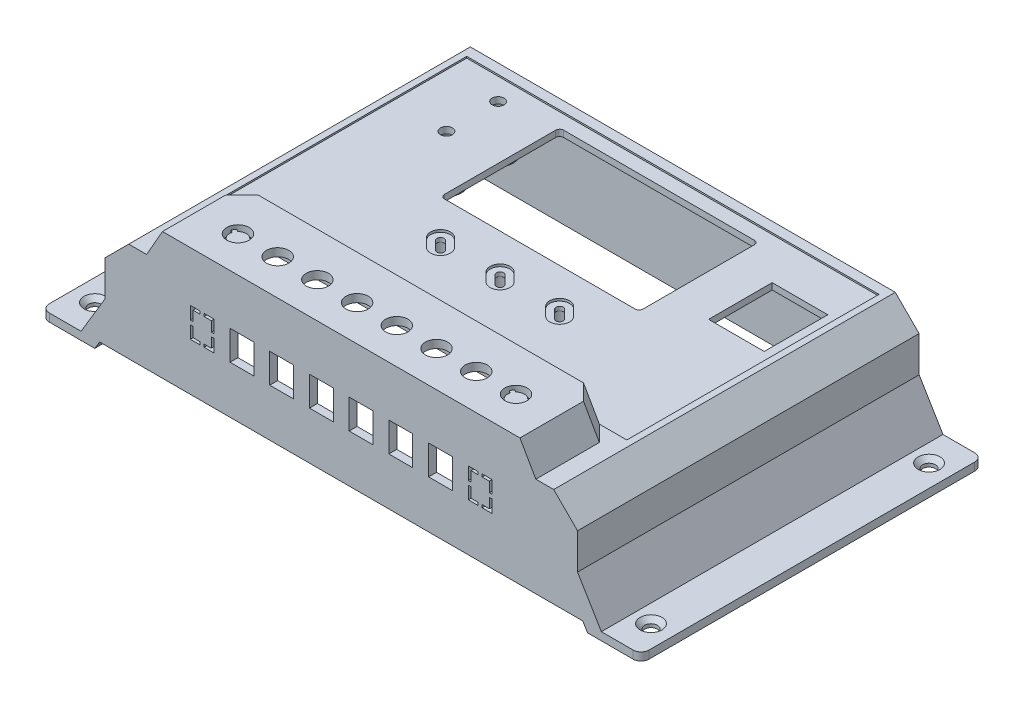
from build123d import *

# Parameters (mm, degrees)
MAIN_BODY_DEPTH           = 43
SHELL1_START              = -41
SHELL1_DEPTH              = 82
SHELL1_START_2            = 27.747091572
SHELL1_2_DEPTH            = 13.252908428
CUT_EXTRUDE2_DEPTH        = 94.301929404
CUT_EXTRUDE2_DEPTH_BACK   = 94.301929404
BOSS_EXTRUDE3_REACH       = 93.92
SKETCH9_R                 = 2.5
SKETCH9_R_2               = 1
BOSS_EXTRUDE4_REACH       = 92.14
SKETCH12_R                = 2.5
SKETCH12_R_2              = 1
MIRROR4_COPY_1_REACH      = 93.92
MIRROR4_COPY_1_SKETCH_R   = 2.5
MIRROR4_COPY_1_SKETCH_R_2 = 1
MIRROR4_COPY_2_REACH      = 92.14
MIRROR4_COPY_2_SKETCH_R   = 2.5
MIRROR4_COPY_2_SKETCH_R_2 = 1
CUT_EXTRUDE3_REACH        = 92.985
SKETCH10_W                = 50
SKETCH10_H                = 30
CUT_EXTRUDE4_REACH        = 92.985
SKETCH11_W                = 14
SKETCH11_H                = 16
CUT_EXTRUDE5_DEPTH        = 91.984889015
BOSS_EXTRUDE9_START       = -1
BOSS_EXTRUDE9_DEPTH       = 1
SKETCH26_R                = 3.4
SKETCH26_R_2              = 2.4
BOSS_EXTRUDE10_DEPTH      = 5.5
SKETCH28_W                = 1
SKETCH28_H                = 6.8
CUT_EXTRUDE10_DEPTH       = 5.5
LPATTERN1_COUNT           = 2
LPATTERN1_PITCH           = 15
LPATTERN1_COL_COUNT       = 2
LPATTERN1_COL_PITCH       = 15
SKETCH14_R                = 1.5
CUT_EXTRUDE6_DEPTH        = 91.984889015
SKETCH15_R                = 2.8
CUT_EXTRUDE7_DEPTH        = 94.301929404
CUT_EXTRUDE8_REACH        = 121.383
SKETCH16_W                = 6
SKETCH16_H                = 7.4
LPATTERN2_COUNT           = 4
LPATTERN2_PITCH           = 10
MIRROR5_COPY_1_SKETCH_R   = 2.8
MIRROR5_COPY_1_DEPTH      = 94.301929404
MIRROR5_COPY_2_SKETCH_R   = 2.8
MIRROR5_COPY_2_DEPTH      = 94.301929404
MIRROR5_COPY_3_SKETCH_R   = 2.8
MIRROR5_COPY_3_DEPTH      = 94.301929404
MIRROR5_COPY_4_REACH      = 121.383
MIRROR5_COPY_4_SKETCH_W   = 6
MIRROR5_COPY_4_SKETCH_H   = 7.4
MIRROR5_COPY_5_REACH      = 121.383
MIRROR5_COPY_5_SKETCH_W   = 6
MIRROR5_COPY_5_SKETCH_H   = 7.4
MIRROR5_COPY_6_REACH      = 121.383
MIRROR5_COPY_6_SKETCH_W   = 6
MIRROR5_COPY_6_SKETCH_H   = 7.4
SKETCH17_R                = 3.75
SKETCH17_R_2              = 1.8
BOSS_EXTRUDE5_DEPTH       = 10
SKETCH18_W                = 1
SKETCH18_H                = 7.4
EXTRUDE_THIN1_DEPTH       = 2
SKETCH19_W                = 6
SKETCH19_H                = 1
EXTRUDE_THIN2_DEPTH       = 2
SKETCH20_W                = 4.6
SKETCH20_H                = 6
BOSS_EXTRUDE6_DEPTH       = 2
SKETCH21_W                = 1
SKETCH21_H                = 2.8
EXTRUDE_THIN3_DEPTH       = 1
CIRPATTERN1_COUNT         = 3
SKETCH22_R                = 2.1
BOSS_EXTRUDE7_DEPTH       = 1
MIRROR6_COPY_1_SKETCH_W   = 1
MIRROR6_COPY_1_SKETCH_H   = 2.8
MIRROR6_COPY_1_DEPTH      = 1
MIRROR6_COPY_2_SKETCH_W   = 1
MIRROR6_COPY_2_SKETCH_H   = 2.8
MIRROR6_COPY_2_DEPTH      = 1
CUT_EXTRUDE9_REACH        = 121.383
SKETCH23_W                = 5.8
SKETCH23_H                = 7.3
SKETCH24_W                = 1
SKETCH24_H                = 7.3
SKETCH24_W_2              = 5.8
SKETCH24_H_2              = 1
EXTRUDE_THIN4_DEPTH       = 1
SKETCH25_W                = 3.8
SKETCH25_H                = 5.3
BOSS_EXTRUDE8_DEPTH       = 1
SKETCH29_W                = 103.8
SKETCH29_H                = 63.5
CUT_EXTRUDE11_DEPTH       = 0.4
FILLET1_R                 = 1
FILLET2_R                 = 2


with BuildPart() as part:
    # Sketch1 → MAIN BODY (new, symmetric)
    with BuildSketch(Plane.XY):
        Polygon((-65.5, 2), (-75.5, 2), (-75.5, 0), (75.5, 0), (75.5, 2), (65.5, 2), (59.5, 12), (59.5, 21), (53.5, 27), (-53.5, 27), (-59.5, 21), (-59.5, 12), align=None)
    extrude(amount=MAIN_BODY_DEPTH, both=True)

    # Sketch2 → Loft1 section 0
    with BuildSketch(Plane(origin=(0, 27, 0), x_dir=(1, 0, 0), z_dir=(0, 1, 0))):
        with BuildLine():
            Line((-49, -43), (-49, -27))
            Line((-49, -27), (-45, -23))
            Line((-45, -23), (45, -23))
            Line((45, -23), (49, -27))
            Line((49, -27), (49, -43))
            Line((49, -43), (-49, -43))
        make_face()
    # Sketch3 → Loft1 section 1
    with BuildSketch(Plane(origin=(0, 34, 0), x_dir=(1, 0, 0), z_dir=(0, 1, 0))):
        with BuildLine():
            Line((45, -43), (-45, -43))
            Line((-45, -43), (-45, -27))
            Line((-45, -27), (-41, -23))
            Line((-41, -23), (41, -23))
            Line((41, -23), (45, -27))
            Line((45, -27), (45, -43))
        make_face()
    loft()

    # Shell1: read off the stored shape, not the designer's step
    # Shell1 outline → Shell1 (cut)
    with BuildSketch(Plane.XY.offset(SHELL1_START)):
        Polygon((-57.5, 11.44603207), (-64.367619242, 0), (64.367619242, 0), (57.5, 11.44603207), (57.5, 20.171572875), (52.671572875, 25), (-52.671572875, 25), (-57.5, 20.171572875), align=None)
    extrude(amount=SHELL1_DEPTH, mode=Mode.SUBTRACT)

    # Shell1 2 outline → Shell1 2 (cut)
    with BuildSketch(Plane.XY.offset(SHELL1_START_2)):
        Polygon((-43.839354929, 32), (-47.839354929, 25), (47.839354929, 25), (43.839354929, 32), align=None)
    extrude(amount=SHELL1_2_DEPTH, mode=Mode.SUBTRACT)

    # Shell1 3: loft between two sections, ruled curve by curve
    shell1_3_from = [
        Edge.make_line((-43.839354929, 32, 27.747091572), (-41.092263357, 32, 25)),
        Edge.make_line((41.092263357, 32, 25), (43.839354929, 32, 27.747091572)),
        Edge.make_line((-41.092263357, 32, 25), (41.092263357, 32, 25)),
        Edge.make_line((43.839354929, 32, 27.747091572), (-43.839354929, 32, 27.747091572)),
    ]
    shell1_3_to = [
        Edge.make_line((-47.839354929, 25, 27.747091572), (-45.092263357, 25, 25)),
        Edge.make_line((45.092263357, 25, 25), (47.839354929, 25, 27.747091572)),
        Edge.make_line((-45.092263357, 25, 25), (45.092263357, 25, 25)),
        Edge.make_line((47.839354929, 25, 27.747091572), (-47.839354929, 25, 27.747091572)),
    ]
    shell1_3 = Solid(Shell([*[Face.make_surface_from_curves(shell1_3_from[k], shell1_3_to[k]) for k in range(4)], Face(Wire(shell1_3_from)), Face(Wire(shell1_3_to))]))
    add(shell1_3, mode=Mode.SUBTRACT)

    # Sketch6 → Cut-Extrude2 (cut, two sides: drawn at the far end of the back side and taken through both)
    with BuildSketch(Plane.XY.offset(-CUT_EXTRUDE2_DEPTH_BACK)):
        Polygon((60.835238484, 2), (-60.835238484, 2), (-62.035238484, 0), (62.035238484, 0), align=None)
    extrude(amount=CUT_EXTRUDE2_DEPTH + CUT_EXTRUDE2_DEPTH_BACK, mode=Mode.SUBTRACT)

    # Sketch8 → M3 Clearance Hole1 (revolve, cut)
    with BuildSketch(Plane(origin=(-70, 2, -35), x_dir=(0, 0, 1), z_dir=(1, 0, 0))):
        Polygon((0, 0), (0, 2), (1.6, 2), (1.6, 1.15), (2.75, 0), align=None)
    m3_clearance_hole1 = revolve(axis=Axis((-70, 8.35, -35), (0, -1, 0)), mode=Mode.SUBTRACT)

    # Mirror1: M3 Clearance Hole1 across plane
    add(m3_clearance_hole1.mirror(Plane.XY), mode=Mode.SUBTRACT)

    # Mirror2: M3 Clearance Hole1 across plane
    add(m3_clearance_hole1.mirror(Plane(origin=(0, 0, 0), x_dir=(0, 0, 1), z_dir=(1, 0, 0))), mode=Mode.SUBTRACT)

    # Mirror2 copy 1 sketch → Mirror2 copy 1 (revolve, cut)
    with BuildSketch(Plane(origin=(70, 2, 35), x_dir=(0, 0, -1), z_dir=(-1, 0, 0))):
        Polygon((0, 0), (0, 2), (1.6, 2), (1.6, 1.15), (2.75, 0), align=None)
    revolve(axis=Axis((70, 8.35, 35), (0, -1, 0)), mode=Mode.SUBTRACT)

    # Sketch9 → Boss-Extrude3 (add, up to next)
    with BuildSketch(Plane.XZ.offset(-4), mode=Mode.PRIVATE) as boss_extrude3_sk1:
        with Locations((-59.5, 32.5)):
            Circle(SKETCH9_R)
        with Locations(Location((-59.5, 32.5, 0), (0, 0, 270))):
            Circle(SKETCH9_R_2, mode=Mode.SUBTRACT)
    boss_extrude3_tool1 = extrude(boss_extrude3_sk1.sketch, amount=-BOSS_EXTRUDE3_REACH, mode=Mode.PRIVATE) - part.part
    boss_extrude3 = boss_extrude3_tool1.solids().sort_by_distance((-61.929289, 4, 32.5))[0]
    add(boss_extrude3)

    # Sketch12 → Boss-Extrude4 (add, up to next)
    with BuildSketch(Plane.XZ.offset(-10), mode=Mode.PRIVATE) as boss_extrude4_sk1:
        with Locations(Location((-52.5, 36, 0), (0, 0, 270))):
            Circle(SKETCH12_R)
        with Locations(Location((-52.5, 36, 0), (0, 0, 270))):
            Circle(SKETCH12_R_2, mode=Mode.SUBTRACT)
    boss_extrude4_tool1 = extrude(boss_extrude4_sk1.sketch, amount=-BOSS_EXTRUDE4_REACH, mode=Mode.PRIVATE) - part.part
    boss_extrude4 = boss_extrude4_tool1.solids().sort_by_distance((-52.5, 10, 38.429289))[0]
    add(boss_extrude4)

    # Mirror3: Boss-Extrude3, Boss-Extrude4 across plane
    add(boss_extrude3.mirror(Plane(origin=(0, 0, 0), x_dir=(0, 0, 1), z_dir=(1, 0, 0))))
    add(boss_extrude4.mirror(Plane(origin=(0, 0, 0), x_dir=(0, 0, 1), z_dir=(1, 0, 0))))

    # Mirror4: Boss-Extrude3, Boss-Extrude4 across plane
    add(boss_extrude3.mirror(Plane.XY))
    add(boss_extrude4.mirror(Plane.XY))

    # Mirror4 copy 1 sketch → Mirror4 copy 1 (add, up to next)
    with BuildSketch(Plane(origin=(0, 4, 0), x_dir=(-1, 0, 0), z_dir=(0, -1, 0)), mode=Mode.PRIVATE) as mirror4_copy_1_sk1:
        with Locations((-59.5, 32.5)):
            Circle(MIRROR4_COPY_1_SKETCH_R)
        with Locations(Location((-59.5, 32.5, 0), (0, 0, 270))):
            Circle(MIRROR4_COPY_1_SKETCH_R_2, mode=Mode.SUBTRACT)
    mirror4_copy_1_tool1 = extrude(mirror4_copy_1_sk1.sketch, amount=-MIRROR4_COPY_1_REACH, mode=Mode.PRIVATE) - part.part
    add(mirror4_copy_1_tool1.solids().sort_by_distance((61.929289, 4, -32.5))[0])

    # Mirror4 copy 2 sketch → Mirror4 copy 2 (add, up to next)
    with BuildSketch(Plane(origin=(0, 10, 0), x_dir=(-1, 0, 0), z_dir=(0, -1, 0)), mode=Mode.PRIVATE) as mirror4_copy_2_sk1:
        with Locations(Location((-52.5, 36, 0), (0, 0, 270))):
            Circle(MIRROR4_COPY_2_SKETCH_R)
        with Locations(Location((-52.5, 36, 0), (0, 0, 270))):
            Circle(MIRROR4_COPY_2_SKETCH_R_2, mode=Mode.SUBTRACT)
    mirror4_copy_2_tool1 = extrude(mirror4_copy_2_sk1.sketch, amount=-MIRROR4_COPY_2_REACH, mode=Mode.PRIVATE) - part.part
    add(mirror4_copy_2_tool1.solids().sort_by_distance((52.5, 10, -38.429289))[0])

    # Sketch10 → Cut-Extrude3 (cut, up to next)
    with BuildSketch(Plane(origin=(0, 27, 0), x_dir=(1, 0, 0), z_dir=(0, 1, 0)), mode=Mode.PRIVATE) as cut_extrude3_sk1:
        with Locations((0, 22)):
            Rectangle(SKETCH10_W, SKETCH10_H)
    cut_extrude3_tool1 = extrude(cut_extrude3_sk1.sketch, amount=-CUT_EXTRUDE3_REACH, mode=Mode.PRIVATE) & part.part
    add(cut_extrude3_tool1.solids().sort_by_distance((0, 27, -22))[0], mode=Mode.SUBTRACT)

    # Sketch11 → Cut-Extrude4 (cut, up to next)
    with BuildSketch(Plane(origin=(0, 27, 0), x_dir=(1, 0, 0), z_dir=(0, 1, 0)), mode=Mode.PRIVATE) as cut_extrude4_sk1:
        with Locations((42.5, 22)):
            Rectangle(SKETCH11_W, SKETCH11_H)
    cut_extrude4_tool1 = extrude(cut_extrude4_sk1.sketch, amount=-CUT_EXTRUDE4_REACH, mode=Mode.PRIVATE) & part.part
    add(cut_extrude4_tool1.solids().sort_by_distance((42.5, 27, -22))[0], mode=Mode.SUBTRACT)

    # Sketch13 → Cut-Extrude5 (cut, through all)
    with BuildSketch(Plane(origin=(0, 27, 0), x_dir=(1, 0, 0), z_dir=(0, 1, 0))):
        with BuildLine():
            Line((0.707106781, -0.171572875), (2.828427125, -2.292893219))
            ThreePointArc((2.828427125, -2.292893219), (2.828427125, -5.828427125), (-0.707106781, -5.828427125))
            Line((-0.707106781, -5.828427125), (-2.828427125, -3.707106781))
            ThreePointArc((-2.828427125, -3.707106781), (-2.828427125, -0.171572875), (0.707106781, -0.171572875))
        make_face()
    cut_extrude5 = extrude(amount=-CUT_EXTRUDE5_DEPTH, mode=Mode.SUBTRACT)

    # Sketch27 → Boss-Extrude9 (add)
    with BuildSketch(Plane.XZ.offset(-25).offset(BOSS_EXTRUDE9_START)):
        with BuildLine():
            Line((0.707106781, 0.171572875), (2.828427125, 2.292893219))
            ThreePointArc((2.828427125, 2.292893219), (2.828427125, 5.828427125), (-0.707106781, 5.828427125))
            Line((-0.707106781, 5.828427125), (-2.828427125, 3.707106781))
            ThreePointArc((-2.828427125, 3.707106781), (-2.828427125, 0.171572875), (0.707106781, 0.171572875))
        make_face()
        with BuildLine():
            Line((-0.424264069, 1.302943725), (1.697056275, 3.424264069))
            ThreePointArc((1.697056275, 3.424264069), (1.697056275, 4.697056275), (0.424264069, 4.697056275))
            Line((0.424264069, 4.697056275), (-1.697056275, 2.575735931))
            ThreePointArc((-1.697056275, 2.575735931), (-1.697056275, 1.302943725), (-0.424264069, 1.302943725))
        make_face(mode=Mode.SUBTRACT)
    boss_extrude9 = extrude(amount=BOSS_EXTRUDE9_DEPTH)

    # Sketch26 → Boss-Extrude10 (add)
    with BuildSketch(Plane.XZ.offset(-25)):
        with Locations(Location((0, 3, 0), (0, 0, 270))):
            Circle(SKETCH26_R)
        with Locations(Location((0, 3, 0), (0, 0, 45))):
            Circle(SKETCH26_R_2, mode=Mode.SUBTRACT)
    boss_extrude10 = extrude(amount=BOSS_EXTRUDE10_DEPTH)

    # Sketch28 → Cut-Extrude10 (cut)
    with BuildSketch(Plane(origin=(0, 19.5, 0), x_dir=(-1, 0, 0), z_dir=(0, -1, 0))):
        with Locations((0, -3)):
            Rectangle(SKETCH28_W, SKETCH28_H)
    cut_extrude10 = extrude(amount=-CUT_EXTRUDE10_DEPTH, mode=Mode.SUBTRACT)

    # LPattern1: Cut-Extrude5, Boss-Extrude9, Boss-Extrude10, Cut-Extrude10 ×2
    with Locations(*[(i * LPATTERN1_PITCH, 0, 0) for i in range(1, LPATTERN1_COUNT)]):
        add(cut_extrude5, mode=Mode.SUBTRACT)
        add(boss_extrude9)
        add(boss_extrude10)
        add(cut_extrude10, mode=Mode.SUBTRACT)

    # LPattern1 col: Cut-Extrude5, Boss-Extrude9, Boss-Extrude10, Cut-Extrude10 ×2
    with Locations(*[(-i * LPATTERN1_COL_PITCH, 0, 0) for i in range(1, LPATTERN1_COL_COUNT)]):
        add(cut_extrude5, mode=Mode.SUBTRACT)
        add(boss_extrude9)
        add(boss_extrude10)
        add(cut_extrude10, mode=Mode.SUBTRACT)

    # Sketch14 → Cut-Extrude6 (cut, through all)
    with BuildSketch(Plane(origin=(0, 27, 0), x_dir=(1, 0, 0), z_dir=(0, 1, 0))):
        with Locations(Location((-38.5, 35, 0), (0, 0, 270))):
            Circle(SKETCH14_R)
        with Locations(Location((-38.5, 22, 0), (0, 0, 270))):
            Circle(SKETCH14_R)
    extrude(amount=-CUT_EXTRUDE6_DEPTH, mode=Mode.SUBTRACT)

    # Sketch15 → Cut-Extrude7 (cut, through all)
    with BuildSketch(Plane(origin=(0, 34, 0), x_dir=(1, 0, 0), z_dir=(0, 1, 0))):
        with Locations(Location((-5, -34, 0), (0, 0, 270))):
            Circle(SKETCH15_R)
    cut_extrude7 = extrude(amount=-CUT_EXTRUDE7_DEPTH, mode=Mode.SUBTRACT)

    # Sketch16 → Cut-Extrude8 (cut, up to next)
    with BuildSketch(Plane.XY.offset(43), mode=Mode.PRIVATE) as cut_extrude8_sk1:
        with Locations((-5, 17.7)):
            Rectangle(SKETCH16_W, SKETCH16_H)
    cut_extrude8_tool1 = extrude(cut_extrude8_sk1.sketch, amount=-CUT_EXTRUDE8_REACH, mode=Mode.PRIVATE) & part.part
    cut_extrude8 = cut_extrude8_tool1.solids().sort_by_distance((-5, 17.7, 43))[0]
    add(cut_extrude8, mode=Mode.SUBTRACT)

    # LPattern2: Cut-Extrude7, Cut-Extrude8 ×4
    with Locations(*[(-i * LPATTERN2_PITCH, 0, 0) for i in range(1, LPATTERN2_COUNT)]):
        add(cut_extrude7, mode=Mode.SUBTRACT)
        add(cut_extrude8, mode=Mode.SUBTRACT)

    # Mirror5: Cut-Extrude7, Cut-Extrude8 across plane
    add(cut_extrude7.mirror(Plane(origin=(0, 0, 0), x_dir=(0, 0, 1), z_dir=(1, 0, 0))), mode=Mode.SUBTRACT)
    add(cut_extrude8.mirror(Plane(origin=(0, 0, 0), x_dir=(0, 0, 1), z_dir=(1, 0, 0))), mode=Mode.SUBTRACT)

    # Mirror5 copy 1 sketch → Mirror5 copy 1 (cut, through all)
    with BuildSketch(Plane(origin=(10, 34, 0), x_dir=(-1, 0, 0), z_dir=(0, 1, 0))):
        with Locations((-5, 34)):
            Circle(MIRROR5_COPY_1_SKETCH_R)
    extrude(amount=-MIRROR5_COPY_1_DEPTH, mode=Mode.SUBTRACT)

    # Mirror5 copy 2 sketch → Mirror5 copy 2 (cut, through all)
    with BuildSketch(Plane(origin=(20, 34, 0), x_dir=(-1, 0, 0), z_dir=(0, 1, 0))):
        with Locations((-5, 34)):
            Circle(MIRROR5_COPY_2_SKETCH_R)
    extrude(amount=-MIRROR5_COPY_2_DEPTH, mode=Mode.SUBTRACT)

    # Mirror5 copy 3 sketch → Mirror5 copy 3 (cut, through all)
    with BuildSketch(Plane(origin=(30, 34, 0), x_dir=(-1, 0, 0), z_dir=(0, 1, 0))):
        with Locations((-5, 34)):
            Circle(MIRROR5_COPY_3_SKETCH_R)
    extrude(amount=-MIRROR5_COPY_3_DEPTH, mode=Mode.SUBTRACT)

    # Mirror5 copy 4 sketch → Mirror5 copy 4 (cut, up to next)
    with BuildSketch(Plane(origin=(10, 0, 43), x_dir=(-1, 0, 0), z_dir=(0, 0, 1)), mode=Mode.PRIVATE) as mirror5_copy_4_sk1:
        with Locations((-5, -17.7)):
            Rectangle(MIRROR5_COPY_4_SKETCH_W, MIRROR5_COPY_4_SKETCH_H)
    mirror5_copy_4_tool1 = extrude(mirror5_copy_4_sk1.sketch, amount=-MIRROR5_COPY_4_REACH, mode=Mode.PRIVATE) & part.part
    add(mirror5_copy_4_tool1.solids().sort_by_distance((15, 17.7, 43))[0], mode=Mode.SUBTRACT)

    # Mirror5 copy 5 sketch → Mirror5 copy 5 (cut, up to next)
    with BuildSketch(Plane(origin=(20, 0, 43), x_dir=(-1, 0, 0), z_dir=(0, 0, 1)), mode=Mode.PRIVATE) as mirror5_copy_5_sk1:
        with Locations((-5, -17.7)):
            Rectangle(MIRROR5_COPY_5_SKETCH_W, MIRROR5_COPY_5_SKETCH_H)
    mirror5_copy_5_tool1 = extrude(mirror5_copy_5_sk1.sketch, amount=-MIRROR5_COPY_5_REACH, mode=Mode.PRIVATE) & part.part
    add(mirror5_copy_5_tool1.solids().sort_by_distance((25, 17.7, 43))[0], mode=Mode.SUBTRACT)

    # Mirror5 copy 6 sketch → Mirror5 copy 6 (cut, up to next)
    with BuildSketch(Plane(origin=(30, 0, 43), x_dir=(-1, 0, 0), z_dir=(0, 0, 1)), mode=Mode.PRIVATE) as mirror5_copy_6_sk1:
        with Locations((-5, -17.7)):
            Rectangle(MIRROR5_COPY_6_SKETCH_W, MIRROR5_COPY_6_SKETCH_H)
    mirror5_copy_6_tool1 = extrude(mirror5_copy_6_sk1.sketch, amount=-MIRROR5_COPY_6_REACH, mode=Mode.PRIVATE) & part.part
    add(mirror5_copy_6_tool1.solids().sort_by_distance((35, 17.7, 43))[0], mode=Mode.SUBTRACT)

    # Sketch17 → Boss-Extrude5 (add)
    # profile 1 of 2: a face of its own
    with BuildSketch(Plane.XZ.offset(-25)):
        with Locations(Location((-38.5, -22, 0), (0, 0, 270))):
            Circle(SKETCH17_R)
        with Locations(Location((-38.5, -22, 0), (0, 0, 270))):
            Circle(SKETCH17_R_2, mode=Mode.SUBTRACT)
    # profile 2 of 2: a face of its own
    with BuildSketch(Plane.XZ.offset(-25)):
        with Locations(Location((-38.5, -35, 0), (0, 0, 270))):
            Circle(SKETCH17_R)
        with Locations(Location((-38.5, -35, 0), (0, 0, 270))):
            Circle(SKETCH17_R_2, mode=Mode.SUBTRACT)
    extrude(amount=BOSS_EXTRUDE5_DEPTH)

    # Sketch18 → Extrude-Thin1 (add)
    with BuildSketch(Plane.XY.offset(43)):
        with Locations((-35, 17.7)):
            Rectangle(SKETCH18_W, SKETCH18_H)
        with Locations((35, 17.7)):
            Rectangle(SKETCH18_W, SKETCH18_H)
    extrude(amount=-EXTRUDE_THIN1_DEPTH)

    # Sketch19 → Extrude-Thin2 (add)
    with BuildSketch(Plane.XY.offset(43)):
        with Locations((-35, 17.7)):
            Rectangle(SKETCH19_W, SKETCH19_H)
        with Locations((35, 17.7)):
            Rectangle(SKETCH19_W, SKETCH19_H)
    extrude(amount=-EXTRUDE_THIN2_DEPTH)

    # Sketch20 → Boss-Extrude6 (add)
    with BuildSketch(Plane.XY.offset(43)):
        with Locations((-35, 17.7)):
            Rectangle(SKETCH20_W, SKETCH20_H)
        with Locations((35, 17.7)):
            Rectangle(SKETCH20_W, SKETCH20_H)
    extrude(amount=-BOSS_EXTRUDE6_DEPTH)

    # Sketch21 → Extrude-Thin3 (add)
    with BuildSketch(Plane.XZ.offset(-32)):
        with Locations((-35, 35.4)):
            Rectangle(SKETCH21_W, SKETCH21_H)
    extrude_thin3 = extrude(amount=-EXTRUDE_THIN3_DEPTH)

    # CirPattern1: Extrude-Thin3 ×3 about axis
    cirpattern1_axis = Axis((-35, 0, 34), (0, 1, 0))
    for i in range(1, CIRPATTERN1_COUNT):
        add(extrude_thin3.rotate(cirpattern1_axis, i * 360 / CIRPATTERN1_COUNT))

    # Sketch22 → Boss-Extrude7 (add)
    with BuildSketch(Plane(origin=(0, 32, 0), x_dir=(-1, 0, 0), z_dir=(0, -1, 0))):
        with Locations((35, -34)):
            Circle(SKETCH22_R)
    boss_extrude7 = extrude(amount=-BOSS_EXTRUDE7_DEPTH)

    # Mirror6: Extrude-Thin3, Boss-Extrude7 across plane
    add(extrude_thin3.mirror(Plane(origin=(0, 0, 0), x_dir=(0, 0, 1), z_dir=(1, 0, 0))))
    add(boss_extrude7.mirror(Plane(origin=(0, 0, 0), x_dir=(0, 0, 1), z_dir=(1, 0, 0))))

    # Mirror6 copy 1 sketch → Mirror6 copy 1 (add)
    with BuildSketch(Plane(origin=(81.944863729, 32, 20.689110868), x_dir=(0.4999999999999998, 0, -0.8660254037844387), z_dir=(0, -1, 0))):
        with Locations((-35, -35.4)):
            Rectangle(MIRROR6_COPY_1_SKETCH_W, MIRROR6_COPY_1_SKETCH_H)
    extrude(amount=-MIRROR6_COPY_1_DEPTH)

    # Mirror6 copy 2 sketch → Mirror6 copy 2 (add)
    with BuildSketch(Plane(origin=(23.055136271, 32, 81.310889132), x_dir=(0.5000000000000004, 0, 0.8660254037844384), z_dir=(0, -1, 0))):
        with Locations((-35, -35.4)):
            Rectangle(MIRROR6_COPY_2_SKETCH_W, MIRROR6_COPY_2_SKETCH_H)
    extrude(amount=-MIRROR6_COPY_2_DEPTH)

    # Sketch23 → Cut-Extrude9 (cut, up to next)
    with BuildSketch(Plane(origin=(0, 0, -43), x_dir=(-1, 0, 0), z_dir=(0, 0, -1)), mode=Mode.PRIVATE) as cut_extrude9_sk1:
        with Locations((-40.4, 13.45)):
            Rectangle(SKETCH23_W, SKETCH23_H)
    cut_extrude9_tool1 = extrude(cut_extrude9_sk1.sketch, amount=-CUT_EXTRUDE9_REACH, mode=Mode.PRIVATE) & part.part
    add(cut_extrude9_tool1.solids().sort_by_distance((40.4, 13.45, -43))[0], mode=Mode.SUBTRACT)

    # Sketch24 → Extrude-Thin4 (add)
    with BuildSketch(Plane(origin=(0, 0, -43), x_dir=(-1, 0, 0), z_dir=(0, 0, -1))):
        with Locations((-40.4, 13.45)):
            Rectangle(SKETCH24_W, SKETCH24_H)
        with Locations((-40.4, 13.45)):
            Rectangle(SKETCH24_W_2, SKETCH24_H_2)
    extrude(amount=-EXTRUDE_THIN4_DEPTH)

    # Sketch25 → Boss-Extrude8 (add)
    with BuildSketch(Plane(origin=(0, 0, -43), x_dir=(-1, 0, 0), z_dir=(0, 0, -1))):
        with Locations((-40.4, 13.45)):
            Rectangle(SKETCH25_W, SKETCH25_H)
    extrude(amount=-BOSS_EXTRUDE8_DEPTH)

    # Sketch29 → Cut-Extrude11 (cut)
    with BuildSketch(Plane(origin=(0, 27, 0), x_dir=(1, 0, 0), z_dir=(0, 1, 0))):
        with Locations((0, 8.75)):
            Rectangle(SKETCH29_W, SKETCH29_H)
    extrude(amount=-CUT_EXTRUDE11_DEPTH, mode=Mode.SUBTRACT)

    # Fillet1
    fillet1_edges = [part.edges().sort_by_distance(p)[0] for p in [
        (25, 25.8, -37),
        (25, 25.8, -7),
        (-25, 25.8, -7),
        (-25, 25.8, -37),
    ]]
    fillet(fillet1_edges, radius=FILLET1_R)

    # Fillet2
    fillet2_edges = [part.edges().sort_by_distance(p)[0] for p in [
        (-75.5, 1, 43),
        (75.5, 1, -43),
        (-75.5, 1, -43),
        (75.5, 1, 43),
    ]]
    fillet(fillet2_edges, radius=FILLET2_R)


solid = part.part
